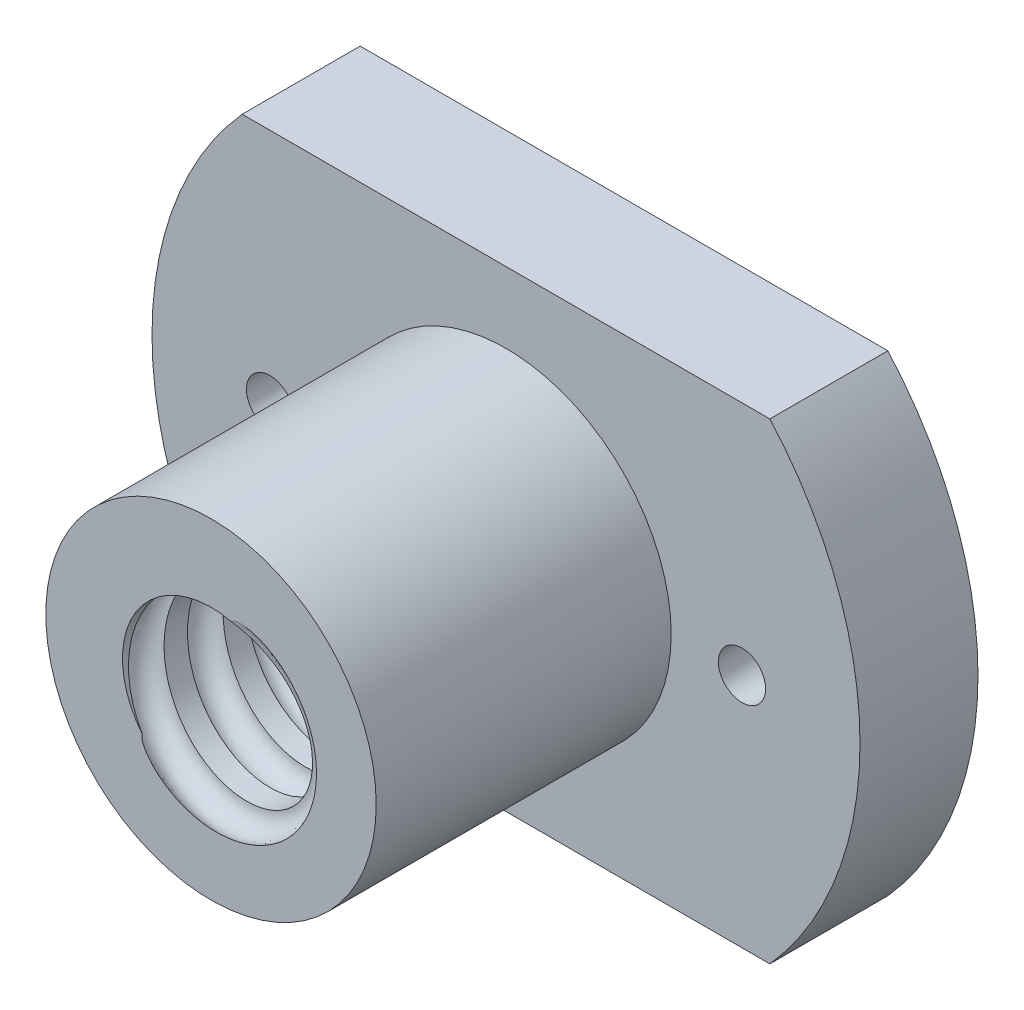
from build123d import *

# Parameters (mm, degrees)
SKETCH1_R           = 14
SKETCH1_R_2         = 7.5
BOSS_EXTRUDE1_DEPTH = 35
CUT_SWEEP1_PITCH    = 5
BOSS_EXTRUDE2_START = -10
SKETCH4_R           = 14
BOSS_EXTRUDE2_DEPTH = 10
SKETCH5_R           = 2
CUT_EXTRUDE1_DEPTH  = 32


with BuildPart() as part:
    # Sketch1 → Boss-Extrude1 (new body)
    with BuildSketch(Plane.XY):
        Circle(SKETCH1_R)
        Circle(SKETCH1_R_2, mode=Mode.SUBTRACT)
    extrude(amount=-BOSS_EXTRUDE1_DEPTH)

    # Cut-Sweep1: the profile of Sketch3 screwed along a right-hand helix of 10 turns, 12 arcs to a turn; built about Z, then put on its axis
    cut_sweep1_z = Axis((0, 0, 0), (0, 0, 1))
    cut_sweep1_corners = [(8.996001669, 0.012814436, -0.108695889), (7.390551354, 0.175154447, -1.485712595), (6.003998331, -0.012814436, 0.108695889), (7.609448646, -0.175154447, 1.485712595)]
    with BuildLine(mode=Mode.PRIVATE) as cut_sweep1_profile:
        ThreePointArc((8.996001669, 0.012814436, -0.108695889), (8.480441045, 0.132914072, -1.127417051), (7.390551354, 0.175154447, -1.485712595))
        ThreePointArc((7.390551354, 0.175154447, -1.485712595), (6.364775195, 0.114791723, -0.97369785), (6.003998331, -0.012814436, 0.108695889))
        ThreePointArc((6.003998331, -0.012814436, 0.108695889), (6.519558955, -0.132914072, 1.127417051), (7.609448646, -0.175154447, 1.485712595))
        ThreePointArc((7.609448646, -0.175154447, 1.485712595), (8.635224805, -0.114791723, 0.97369785), (8.996001669, 0.012814436, -0.108695889))
    cut_sweep1_cap = Face(cut_sweep1_profile.wire())
    cut_sweep1_arcs = [((8.996001669, 0.012814436, -0.108695889), (8.886553023, 0.187968883, -1.594408484), (7.390551354, 0.175154447, -1.485712595), (1, 0.7071067811865475, 1)), ((7.390551354, 0.175154447, -1.485712595), (5.894549685, 0.162340011, -1.377016705), (6.003998331, -0.012814436, 0.108695889), (1, 0.7071067811865475, 1)), ((6.003998331, -0.012814436, 0.108695889), (6.113446977, -0.187968883, 1.594408484), (7.609448646, -0.175154447, 1.485712595), (1, 0.7071067811865475, 1)), ((7.609448646, -0.175154447, 1.485712595), (9.105450315, -0.162340011, 1.377016705), (8.996001669, 0.012814436, -0.108695889), (1, 0.7071067811865475, 1))]  # start, shoulder, end, weights
    cut_sweep1_turn_angles = [0, 15, 30, 45, 60, 75, 90, 105, 120, 135, 150, 165, 180, 195, 210, 225, 240, 255, 270, 285, 300, 315, 330, 345, 360]
    cut_sweep1_turn_weights = [1, 0.9659258262890683, 1, 0.9659258262890683, 1, 0.9659258262890683, 1, 0.9659258262890683, 1, 0.9659258262890683, 1, 0.9659258262890683, 1, 0.9659258262890683, 1, 0.9659258262890683, 1, 0.9659258262890683, 1, 0.9659258262890683, 1, 0.9659258262890683, 1, 0.9659258262890683, 1]
    cut_sweep1_turn_sides = [Face.make_bezier_surface([[Vector(p[j][0], p[j][1], 0).rotate(cut_sweep1_z, cut_sweep1_turn_angles[2 * i + k]) / cut_sweep1_turn_weights[2 * i + k] + Vector(0, 0, p[j][2] + CUT_SWEEP1_PITCH * cut_sweep1_turn_angles[2 * i + k] / 360) for k in range(3)] for j in range(3)], [[p[3][j] * cut_sweep1_turn_weights[2 * i + k] for k in range(3)] for j in range(3)]) for p in cut_sweep1_arcs for i in range(12)]
    cut_sweep1 = Plane(origin=(0, 0, -35), x_dir=(0.8480480961564257, -0.5299192642332055, 0), z_dir=(0, 0, 1)) * Solid(Shell([*[p.moved(Location((0, 0, CUT_SWEEP1_PITCH * i))) for i in range(10) for p in cut_sweep1_turn_sides], cut_sweep1_cap, cut_sweep1_cap.rotate(cut_sweep1_z, 3600).moved(Location((0, 0, CUT_SWEEP1_PITCH * 3600 / 360)))]))
    add(cut_sweep1, mode=Mode.SUBTRACT)

    # Sketch4 → Boss-Extrude2 (add)
    with BuildSketch(Plane(origin=(0, 0, -35), x_dir=(-1, 0, 0), z_dir=(0, 0, -1)).offset(BOSS_EXTRUDE2_START)):
        with BuildLine():
            Line((22.360679775, 20), (-22.360679775, 20))
            ThreePointArc((-22.360679775, 20), (-30, 0), (-22.360679775, -20))
            Line((-22.360679775, -20), (22.360679775, -20))
            ThreePointArc((22.360679775, -20), (30, 0), (22.360679775, 20))
        make_face()
        with Locations(Location((0, 0, 0), (0, 0, 180))):
            Circle(SKETCH4_R, mode=Mode.SUBTRACT)
    extrude(amount=BOSS_EXTRUDE2_DEPTH)

    # Sketch5 → Cut-Extrude1 (cut)
    with BuildSketch(Plane(origin=(0, 0, -35), x_dir=(-1, 0, 0), z_dir=(0, 0, -1))):
        with Locations((20, 0)):
            Circle(SKETCH5_R)
        with Locations((-20, 0)):
            Circle(SKETCH5_R)
    extrude(amount=-CUT_EXTRUDE1_DEPTH, mode=Mode.SUBTRACT)


solid = part.part
